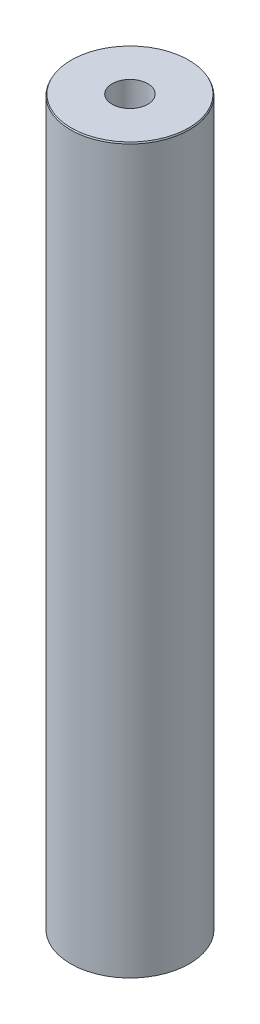
from build123d import *
from OCP.BRepFilletAPI import BRepFilletAPI_MakeChamfer

# Parameters (mm, degrees)
SKETCH1_R           = 47.5
BOSS_EXTRUDE1_DEPTH = 578.925987917
SKETCH2_R           = 14.27894218
CUT_EXTRUDE1_DEPTH  = 583.810260278
CHAMFER1_SIZE       = 1.083606896
CHAMFER1_SIZE2      = 0.522423361


with BuildPart() as part:
    # Sketch1 → Boss-Extrude1 (new body)
    with BuildSketch(Plane(origin=(0, 0, 0), x_dir=(1, 0, 0), z_dir=(0, 1, 0))):
        Circle(SKETCH1_R)
    extrude(amount=BOSS_EXTRUDE1_DEPTH)

    # Sketch2 → Cut-Extrude1 (cut, through all)
    with BuildSketch(Plane(origin=(0, 0, 0), x_dir=(1, 0, 0), z_dir=(0, 1, 0))):
        Circle(SKETCH2_R)
    extrude(amount=CUT_EXTRUDE1_DEPTH, mode=Mode.SUBTRACT)

    # Chamfer1: one chamfer whose edges measure the first distance from different faces: ONE call of the kernel's chamfer builder (chamfer() names one face for all edges)
    chamfer1_edges_1 = [part.edges().sort_by_distance(p)[0] for p in [
        (-47.5, 578.925987917, 0),
    ]]
    chamfer1_side_1 = [part.faces().sort_by_distance(p)[0] for p in [
        (-47.5, 289.462993958, 0),
    ]]
    chamfer1_edges_2 = [part.edges().sort_by_distance(p)[0] for p in [
        (-47.5, 0, 0),
    ]]
    chamfer1_side_2 = [part.faces().sort_by_distance(p)[0] for p in [
        (-46.156497116, 0, 0),
    ]]
    chamfer1 = BRepFilletAPI_MakeChamfer(part.part.solid().wrapped)
    for e in chamfer1_edges_1:
        chamfer1.Add(CHAMFER1_SIZE, CHAMFER1_SIZE2, e.wrapped, chamfer1_side_1[0].wrapped)  # the first distance lies on this face
    for e in chamfer1_edges_2:
        chamfer1.Add(CHAMFER1_SIZE, CHAMFER1_SIZE2, e.wrapped, chamfer1_side_2[0].wrapped)  # the first distance lies on this face
    add(Compound.cast(chamfer1.Shape()), mode=Mode.REPLACE)


solid = part.part
